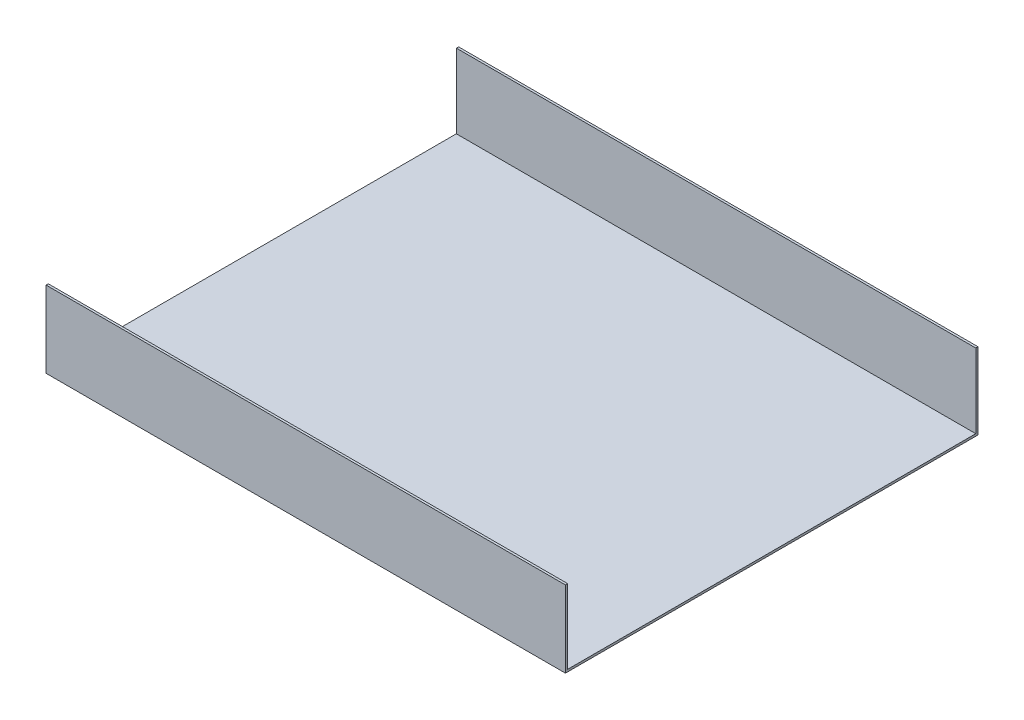
from build123d import *

# Parameters (mm, degrees)
CROQUIS1_W              = 110
CROQUIS1_H              = 20
SALIENTE_EXTRUIR1_DEPTH = 140
VACIADO1_T              = 0.6


with BuildPart() as part:
    # Croquis1 → Saliente-Extruir1 (new body)
    with BuildSketch(Plane(origin=(0, 0, 0), x_dir=(0, 0, -1), z_dir=(1, 0, 0))):
        with Locations((55, 10)):
            Rectangle(CROQUIS1_W, CROQUIS1_H)
    extrude(amount=SALIENTE_EXTRUIR1_DEPTH)

    # Vaciado1
    vaciado1_openings = [part.faces().sort_by_distance(p)[0] for p in [
        (0, 10, -55),
        (140, 10, -55),
        (70, 20, -55),
    ]]
    offset(amount=VACIADO1_T, openings=vaciado1_openings, kind=Kind.INTERSECTION)


solid = part.part
